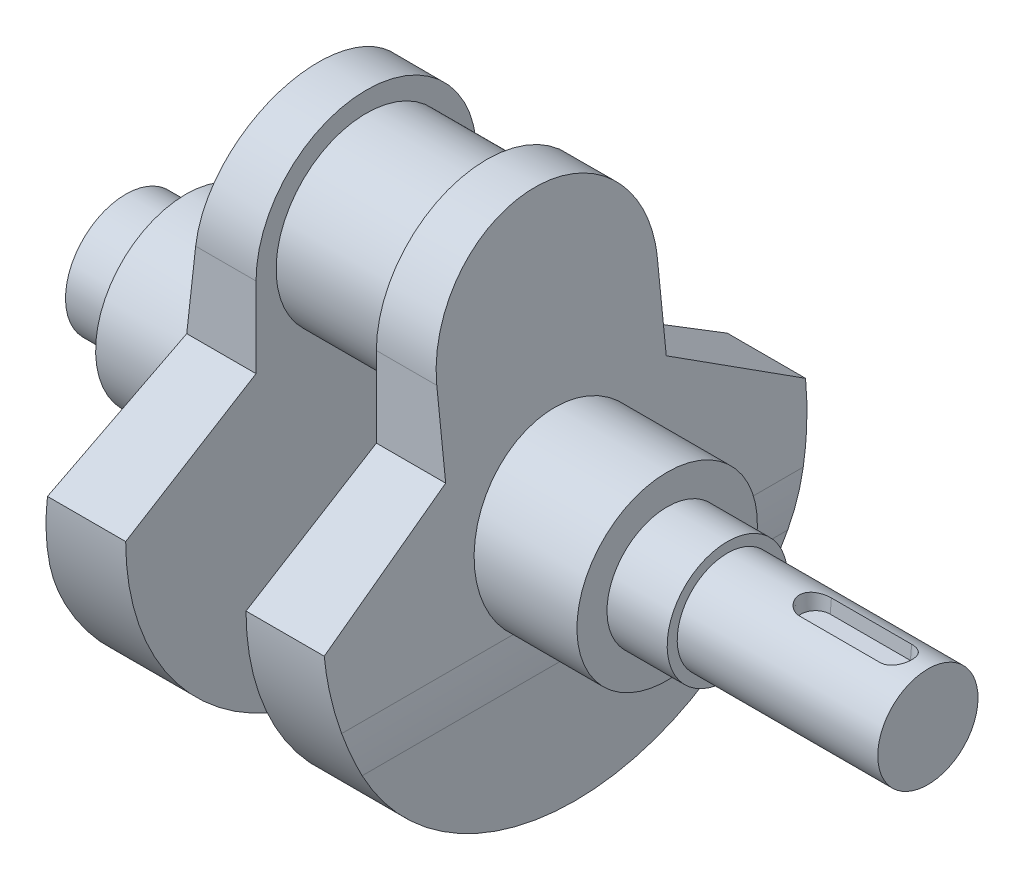
from build123d import *

# Parameters (mm, degrees)
SKETCH2_R                    = 22.5
BOSS_EXTRUDE1_DEPTH          = 15
BOSS_EXTRUDE2_DEPTH          = 22
CUT_EXTRUDE1_DEPTH           = 123.347864714
CUT_EXTRUDE1_DEPTH_BACK      = 123.347864714
FILLET1_R                    = 100
CUT_EXTRUDE2_START           = -27.5
CUT_EXTRUDE2_DEPTH           = 4
CUT_EXTRUDE2_TAPER           = 5
CUT_EXTRUDE2_OTHER_WAY_DEPTH = 199.453210066
CUT_EXTRUDE3_DEPTH           = 171.953210139
CUT_EXTRUDE3_DEPTH_BACK      = 171.953210139


with BuildPart() as part:
    # Sketch2 → Boss-Extrude1 (new body)
    with BuildSketch(Plane(origin=(0, 0, 0), x_dir=(0, 0, -1), z_dir=(1, 0, 0))):
        Circle(SKETCH2_R)
    extrude(amount=BOSS_EXTRUDE1_DEPTH)

    # Sketch3 → Boss-Extrude2 (add)
    with BuildSketch(Plane(origin=(15, 0, 0), x_dir=(0, 0, -1), z_dir=(1, 0, 0))):
        with BuildLine():
            Line((-27.5, 0), (-27.5, -20))
            Line((-27.5, -20), (-60, -40))
            ThreePointArc((-60, -40), (0, -100), (60, -40))
            Line((60, -40), (27.5, -20))
            Line((27.5, -20), (27.5, 0))
            ThreePointArc((27.5, 0), (0, 27.5), (-27.5, 0))
        make_face()
    extrude(amount=BOSS_EXTRUDE2_DEPTH)

    # Sketch6 → Cut-Extrude1 (cut, two sides: drawn at the far end of the back side and taken through both)
    with BuildSketch(Plane.XY.offset(-CUT_EXTRUDE1_DEPTH_BACK)):
        Polygon((37, 27.5), (27, 27.5), (37, -62.5), align=None)
    extrude(amount=CUT_EXTRUDE1_DEPTH + CUT_EXTRUDE1_DEPTH_BACK, mode=Mode.SUBTRACT)

    # Fillet1
    fillet1_edges = [part.edges().sort_by_distance(p)[0] for p in [
        (37, -62.5, 0),
    ]]
    fillet(fillet1_edges, radius=FILLET1_R)

    # Sketch8 → Revolve1 (revolve)
    with BuildSketch(Plane.XY):
        Polygon((32, -17.5), (60, -17.5), (60, -25), (75, -25), (75, -27.5), (125, -27.5), (125, -40), (32, -40), align=None)
    revolve(axis=Axis((125, -40, 0), (-1, 0, 0)))

    # Sketch9 → Cut-Extrude2 (cut)
    with BuildSketch(Plane(origin=(0, 0, 0), x_dir=(1, 0, 0), z_dir=(0, 1, 0)).offset(CUT_EXTRUDE2_START)):
        with BuildLine():
            ThreePointArc((117, -4), (121, 0), (117, 4))
            Line((117, 4), (97, 4))
            ThreePointArc((97, 4), (93, 0), (97, -4))
            Line((97, -4), (117, -4))
        make_face()
    extrude(amount=-CUT_EXTRUDE2_DEPTH, taper=CUT_EXTRUDE2_TAPER, mode=Mode.SUBTRACT)

    # Sketch9 → Cut-Extrude2 other way (cut)
    with BuildSketch(Plane(origin=(0, 0, 0), x_dir=(1, 0, 0), z_dir=(0, 1, 0)).offset(CUT_EXTRUDE2_START)):
        with BuildLine():
            ThreePointArc((117, -4), (121, 0), (117, 4))
            Line((117, 4), (97, 4))
            ThreePointArc((97, 4), (93, 0), (97, -4))
            Line((97, -4), (117, -4))
        make_face()
    extrude(amount=CUT_EXTRUDE2_OTHER_WAY_DEPTH, mode=Mode.SUBTRACT)

    # Mirror1: part across plane


with BuildPart() as part_1:
    add(part.part)
    add(part.part.mirror(Plane(origin=(0, 0, 0), x_dir=(0, 0, 1), z_dir=(1, 0, 0))))

    # Sketch10 → Cut-Extrude3 (cut, two sides: drawn at the far end of the back side and taken through both)
    with BuildSketch(Plane.XY.offset(-CUT_EXTRUDE3_DEPTH_BACK)):
        Polygon((-75, -536.475898777), (-75, -74.418396776), (-75, 5.304302941), (-75, 467.361804943), (-999.115004003, 467.361804943), (-999.115004003, -536.475898777), align=None)
    extrude(amount=CUT_EXTRUDE3_DEPTH + CUT_EXTRUDE3_DEPTH_BACK, mode=Mode.SUBTRACT)


solid = part_1.part
